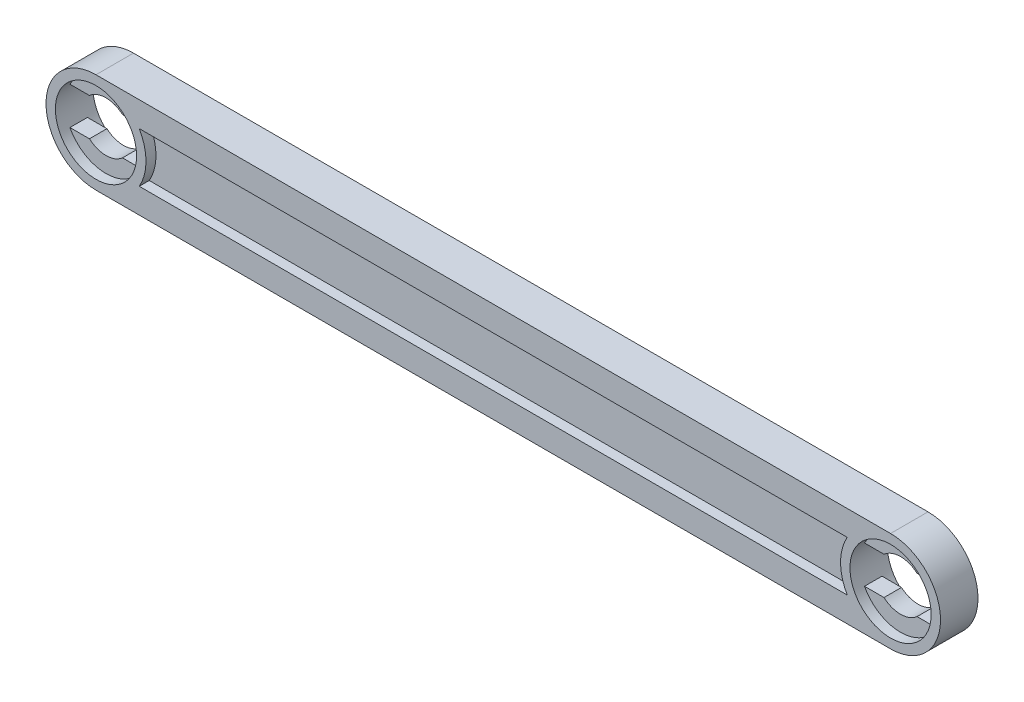
from build123d import *

# Parameters (mm, degrees)
EXTRUDE_1_DEPTH        = 3
CUT_EXTRUDE_1_REACH    = 69.785
SKETCH_3_R             = 3.25
CUT_EXTRUDE_2_DEPTH    = 0.8
CUT_EXTRUDE_START      = -2.2
SKETCH_3_2_R           = 3.25
CUT_EXTRUDE_3_DEPTH    = 0.8
PATTERN_LINEAR_1_COUNT = 2
PATTERN_LINEAR_1_PITCH = 63.6
CUT_EXTRUDE_4_DEPTH    = 0.8
SKETCH_5_W             = 55.6
SKETCH_5_H             = 4
CUT_EXTRUDE_5_DEPTH    = 0.8


with BuildPart() as part:
    # 草图1 → 凸台-拉伸1 (new body)
    with BuildSketch(Plane.XY):
        with BuildLine():
            Line((0, 4), (63.6, 4))
            ThreePointArc((63.6, 4), (67.6, 0), (63.6, -4))
            Line((63.6, -4), (0, -4))
            ThreePointArc((0, -4), (-4, 0), (0, 4))
        make_face()
    extrude(amount=-EXTRUDE_1_DEPTH)

    # 草图2 → 切除-拉伸1 (cut, up to next)
    with BuildSketch(Plane.XY, mode=Mode.PRIVATE) as cut_extrude_1_sk1:
        with BuildLine():
            Line((1.322875656, -1.5), (2.883140649, -1.5))
            ThreePointArc((2.883140649, -1.5), (3.25, 0), (2.883140649, 1.5))
            Line((2.883140649, 1.5), (1.322875656, 1.5))
            ThreePointArc((1.322875656, 1.5), (0, 2), (-1.322875656, 1.5))
            Line((-1.322875656, 1.5), (-2.883140649, 1.5))
            ThreePointArc((-2.883140649, 1.5), (-3.25, 0), (-2.883140649, -1.5))
            Line((-2.883140649, -1.5), (-1.322875656, -1.5))
            ThreePointArc((-1.322875656, -1.5), (0, -2), (1.322875656, -1.5))
        make_face()
    cut_extrude_1_tool1 = extrude(cut_extrude_1_sk1.sketch, amount=-CUT_EXTRUDE_1_REACH, mode=Mode.PRIVATE) & part.part
    cut_extrude_1 = cut_extrude_1_tool1.solids().sort_by_distance((0, 0, 0))[0]
    add(cut_extrude_1, mode=Mode.SUBTRACT)

    # 草图3 → 切除-拉伸2 (cut)
    with BuildSketch(Plane.XY):
        Circle(SKETCH_3_R)
    cut_extrude_2 = extrude(amount=-CUT_EXTRUDE_2_DEPTH, mode=Mode.SUBTRACT)

    # 草图3<2> → 切除-拉伸3 (cut)
    with BuildSketch(Plane.XY.offset(CUT_EXTRUDE_START)):
        Circle(SKETCH_3_2_R)
    cut_extrude_3 = extrude(amount=-CUT_EXTRUDE_3_DEPTH, mode=Mode.SUBTRACT)

    # 阵列(线性)1: 切除-拉伸1, 切除-拉伸2, 切除-拉伸3 ×2
    with Locations(*[(i * PATTERN_LINEAR_1_PITCH, 0, 0) for i in range(1, PATTERN_LINEAR_1_COUNT)]):
        add(cut_extrude_1, mode=Mode.SUBTRACT)
        add(cut_extrude_2, mode=Mode.SUBTRACT)
        add(cut_extrude_3, mode=Mode.SUBTRACT)

    # 草图4 → 切除-拉伸4 (cut)
    with BuildSketch(Plane.XY):
        with BuildLine():
            Line((3.464101615, 2), (60.135898385, 2))
            ThreePointArc((60.135898385, 2), (59.6, 0), (60.135898385, -2))
            Line((60.135898385, -2), (3.464101615, -2))
            ThreePointArc((3.464101615, -2), (4, 0), (3.464101615, 2))
        make_face()
    extrude(amount=-CUT_EXTRUDE_4_DEPTH, mode=Mode.SUBTRACT)

    # 草图5 → 切除-拉伸5 (cut)
    with BuildSketch(Plane(origin=(0, 0, -3), x_dir=(-1, 0, 0), z_dir=(0, 0, -1))):
        with Locations((-31.8, 0)):
            Rectangle(SKETCH_5_W, SKETCH_5_H)
    extrude(amount=-CUT_EXTRUDE_5_DEPTH, mode=Mode.SUBTRACT)


solid = part.part
